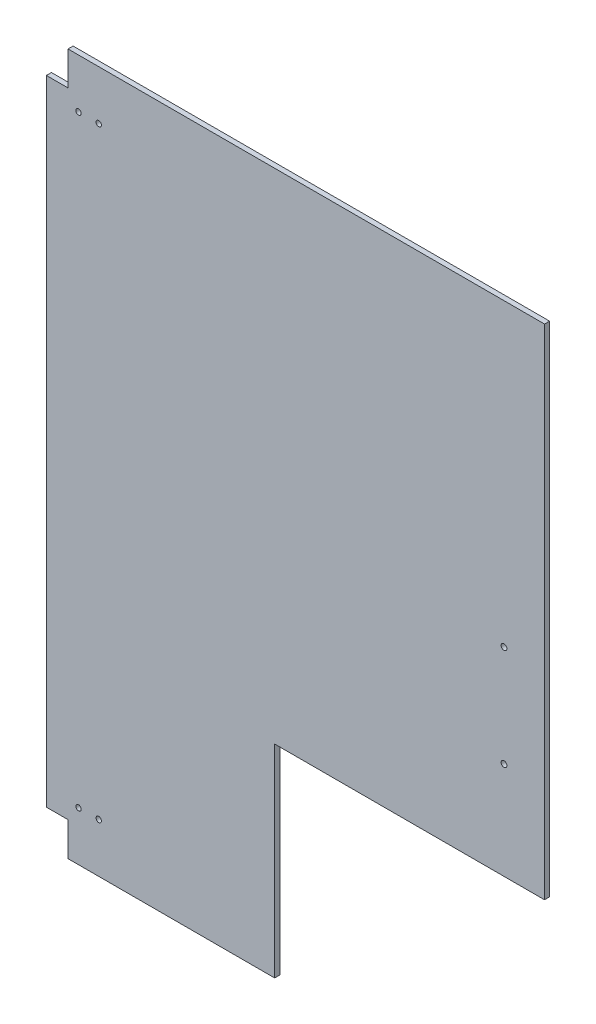
from build123d import *

# Parameters (mm, degrees)
BOSS_EXTRUDE1_DEPTH          = 3
SKETCH2_W                    = 10
SKETCH2_H                    = 416.9
BOSS_EXTRUDE2_DEPTH          = 0.1
CUT_EXTRUDE1_DEPTH           = 10
M3_CLEARANCE_HOLE1_OUTLINE_R = 1.6
M3_CLEARANCE_HOLE1_DEPTH     = 3
M3_CLEARANCE_HOLE2_OUTLINE_R = 1.7
M3_CLEARANCE_HOLE2_DEPTH     = 3
SKETCH6_W                    = 5
SKETCH6_H                    = 296.9
CUT_EXTRUDE2_DEPTH           = 10
MOVE_FACE1_BY                = 0.8
MOVE_FACE1_2_BY              = 0.8
MOVE_FACE1_3_BY              = 0.8
MOVE_FACE1_4_BY              = 0.8
MOVE_FACE1_5_BY              = 0.8
MOVE_FACE1_6_BY              = 0.8
MOVE_FACE1_7_BY              = 0.8
MOVE_FACE1_8_BY              = 0.8


# Read off the part's stored shape, not the designer's step: M3 Clearance Hole1, M3 Clearance Hole2
with BuildPart() as part:
    # Sketch1 → Boss-Extrude1 (new body)
    with BuildSketch(Plane.XY):
        Polygon((0, 0), (136, 0), (136, 120), (300, 120), (300, 416.9), (0, 416.9), align=None)
    extrude(amount=BOSS_EXTRUDE1_DEPTH)


with BuildPart() as body_2:
    # Sketch2 → Boss-Extrude2 (new body)
    with BuildSketch(Plane.XY):
        with Locations((1, 208.45)):
            Rectangle(SKETCH2_W, SKETCH2_H)
    extrude(amount=-BOSS_EXTRUDE2_DEPTH)


with BuildPart() as cut_extrude1_tool:
    # Sketch3 → Cut-Extrude1 (new body)
    with BuildSketch(Plane.XY.offset(3)):
        Polygon((0, 416.9), (-4, 416.9), (-4, 396.9), (0, 396.9), (12, 396.9), (12, 416.9), align=None)
        Polygon((0, 0), (12, 0), (12, 20), (0, 20), (-4, 20), (-4, 0), align=None)
    extrude(amount=-CUT_EXTRUDE1_DEPTH)


with BuildPart() as part_1:
    add(part.part)

    # Cut-Extrude1: cut by cut_extrude1_tool
    add(cut_extrude1_tool.part, mode=Mode.SUBTRACT)

    # M3 Clearance Hole1 outline → M3 Clearance Hole1 (cut)
    with BuildSketch(Plane.XY):
        with Locations((31, 30)):
            Circle(M3_CLEARANCE_HOLE1_OUTLINE_R)
        with Locations((19, 30)):
            Circle(M3_CLEARANCE_HOLE1_OUTLINE_R)
        with Locations((31, 386.9)):
            Circle(M3_CLEARANCE_HOLE1_OUTLINE_R)
        with Locations((19, 386.9)):
            Circle(M3_CLEARANCE_HOLE1_OUTLINE_R)
    extrude(amount=M3_CLEARANCE_HOLE1_DEPTH, mode=Mode.SUBTRACT)

    # M3 Clearance Hole2 outline → M3 Clearance Hole2 (cut)
    with BuildSketch(Plane.XY):
        with Locations((271, 178.45)):
            Circle(M3_CLEARANCE_HOLE2_OUTLINE_R)
        with Locations((271, 238.45)):
            Circle(M3_CLEARANCE_HOLE2_OUTLINE_R)
    extrude(amount=M3_CLEARANCE_HOLE2_DEPTH, mode=Mode.SUBTRACT)

    # Sketch6 → Cut-Extrude2 (cut)
    with BuildSketch(Plane.XY.offset(3)):
        with Locations((297.5, 268.45)):
            Rectangle(SKETCH6_W, SKETCH6_H)
    extrude(amount=-CUT_EXTRUDE2_DEPTH, mode=Mode.SUBTRACT)

    # Move Face1: a face moved inward by 0.8
    extrude(part_1.faces().sort_by_distance((215.5, 120, 1.5))[0], amount=MOVE_FACE1_BY, dir=(0, 1, 0), mode=Mode.SUBTRACT)

    # Move Face1 2: a face moved inward by 0.8
    extrude(part_1.faces().sort_by_distance((136, 60, 1.5))[0], amount=MOVE_FACE1_2_BY, dir=(-1, 0, 0), mode=Mode.SUBTRACT)

    # Move Face1 3: a face moved inward by 0.8
    extrude(part_1.faces().sort_by_distance((74, 0, 1.5))[0], amount=MOVE_FACE1_3_BY, dir=(0, 1, 0), mode=Mode.SUBTRACT)

    # Move Face1 4: a face moved inward by 0.8
    extrude(part_1.faces().sort_by_distance((12, 10, 1.5))[0], amount=MOVE_FACE1_4_BY, dir=(1, 0, 0), mode=Mode.SUBTRACT)

    # Move Face1 5: a face moved inward by 0.8
    extrude(part_1.faces().sort_by_distance((6, 20, 1.5))[0], amount=MOVE_FACE1_5_BY, dir=(0, 1, 0), mode=Mode.SUBTRACT)

    # Move Face1 6: a face moved inward by 0.8
    extrude(part_1.faces().sort_by_distance((153.5, 416.9, 1.5))[0], amount=MOVE_FACE1_6_BY, dir=(0, -1, 0), mode=Mode.SUBTRACT)

    # Move Face1 7: a face moved inward by 0.8
    extrude(part_1.faces().sort_by_distance((12, 406.9, 1.5))[0], amount=MOVE_FACE1_7_BY, dir=(1, 0, 0), mode=Mode.SUBTRACT)

    # Move Face1 8: a face moved inward by 0.8
    extrude(part_1.faces().sort_by_distance((6, 396.9, 1.5))[0], amount=MOVE_FACE1_8_BY, dir=(0, -1, 0), mode=Mode.SUBTRACT)


with BuildPart() as body_2_1:
    add(body_2.part)

    # Cut-Extrude1: cut by cut_extrude1_tool
    add(cut_extrude1_tool.part, mode=Mode.SUBTRACT)


solid = part_1.part
